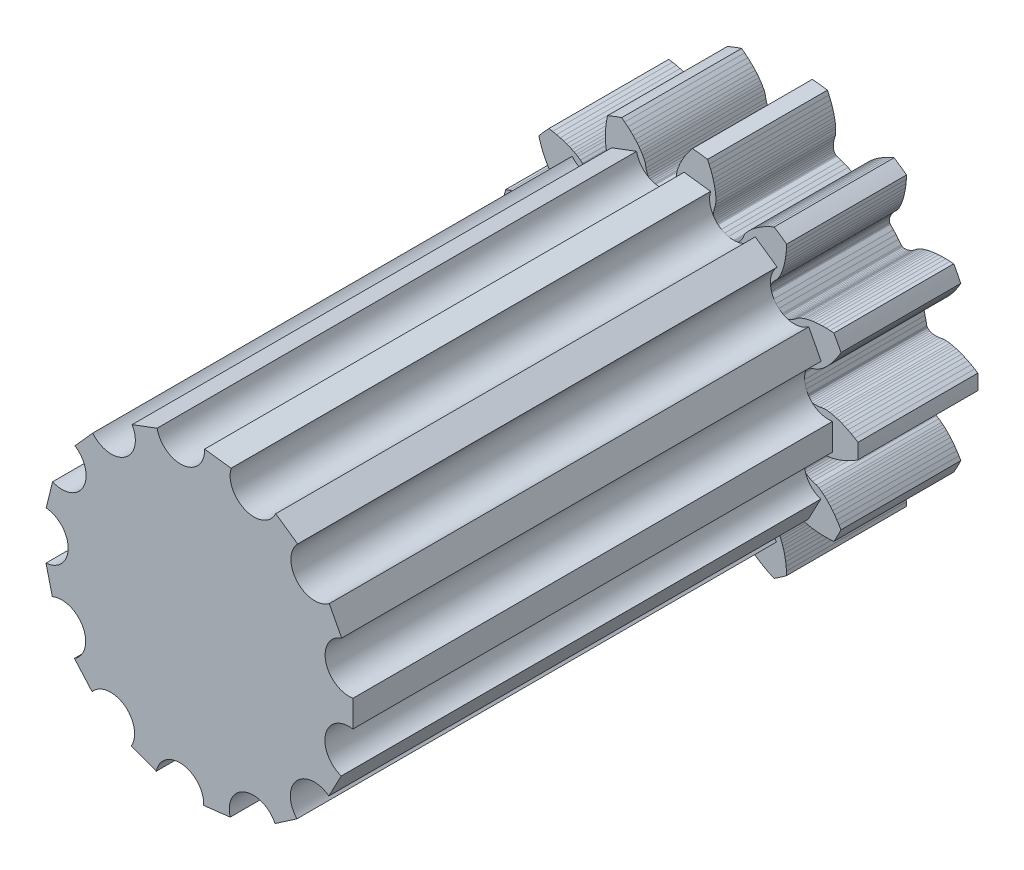
from build123d import *

# Parameters (mm, degrees)
MODEL_R             = 0.75
BOSS_EXTRUDE1_DEPTH = 5
BOSS_EXTRUDE2_DEPTH = 20


with BuildPart() as part:
    # Model → Boss-Extrude1 (new body)
    with BuildSketch(Plane.XY):
        with BuildLine():
            Line((13.7260021, -4.5793472), (13.7795433, -4.4215508))
            Line((13.7795433, -4.4215508), (13.8361657, -4.2750909))
            Line((13.8361657, -4.2750909), (13.8946398, -4.1408954))
            Line((13.8946398, -4.1408954), (13.9531112, -4.0206601))
            Line((13.9531112, -4.0206601), (14.0125959, -3.9103171))
            Line((14.0125959, -3.9103171), (14.0709776, -3.8121176))
            Line((14.0709776, -3.8121176), (14.1273517, -3.7257798))
            Line((14.1273517, -3.7257798), (14.1809425, -3.6507508))
            Line((14.1809425, -3.6507508), (14.2314909, -3.585913))
            Line((14.2314909, -3.585913), (14.3186959, -3.4872224))
            Line((14.3186959, -3.4872224), (14.4038321, -3.4081956))
            Line((14.4038321, -3.4081956), (14.5510585, -3.3203205))
            Line((14.5510585, -3.3203205), (14.6360097, -3.2587152))
            Line((14.6360097, -3.2587152), (14.7072172, -3.1962934))
            Line((14.7072172, -3.1962934), (14.7647907, -3.1340817))
            Line((14.7647907, -3.1340817), (14.8088891, -3.0731147))
            Line((14.8088891, -3.0731147), (14.8397293, -3.014408))
            Line((14.8397293, -3.014408), (14.8576125, -2.9589443))
            Line((14.8576125, -2.9589443), (14.8628531, -2.9077103))
            Line((14.8628531, -2.9077103), (14.8608788, -2.8839796))
            Line((14.8608788, -2.8839796), (14.8558904, -2.8616501))
            Line((14.8558904, -2.8616501), (14.8429207, -2.831064))
            Line((14.8429207, -2.831064), (14.7494086, -2.6710529))
            Line((14.7494086, -2.6710529), (14.6742647, -2.5327413))
            Line((14.6742647, -2.5327413), (14.603123, -2.3923291))
            Line((14.603123, -2.3923291), (14.5245574, -2.2244735))
            Line((14.5245574, -2.2244735), (14.5067531, -2.1964247))
            Line((14.5067531, -2.1964247), (14.4912101, -2.1796348))
            Line((14.4912101, -2.1796348), (14.4728017, -2.1645293))
            Line((14.4728017, -2.1645293), (14.4276599, -2.1397381))
            Line((14.4276599, -2.1397381), (14.3718553, -2.1229486))
            Line((14.3718553, -2.1229486), (14.3060215, -2.1149804))
            Line((14.3060215, -2.1149804), (14.2307959, -2.1166396))
            Line((14.2307959, -2.1166396), (14.1468912, -2.1286813))
            Line((14.1468912, -2.1286813), (14.0550685, -2.1518243))
            Line((14.0550685, -2.1518243), (13.9561106, -2.186742))
            Line((13.9561106, -2.186742), (13.8001567, -2.2579882))
            Line((13.8001567, -2.2579882), (13.686756, -2.2831616))
            Line((13.686756, -2.2831616), (13.5559972, -2.2988672))
            Line((13.5559972, -2.2988672), (13.473922, -2.3036357))
            Line((13.473922, -2.3036357), (13.3817313, -2.3051187))
            Line((13.3817313, -2.3051187), (13.2786525, -2.3024682))
            Line((13.2786525, -2.3024682), (13.1646713, -2.2947317))
            Line((13.1646713, -2.2947317), (13.0400696, -2.2810047))
            Line((13.0400696, -2.2810047), (12.9079024, -2.2608243))
            Line((12.9079024, -2.2608243), (12.7642446, -2.2327158))
            Line((12.7642446, -2.2327158), (12.6115452, -2.1961165))
            Line((12.6115452, -2.1961165), (12.4512665, -2.1505414))
            Line((12.4512665, -2.1505414), (12.300297737, -2.10092279))
            ThreePointArc((12.300297737, -2.10092279), (12.217962976, -1.794860908), (12.148632736, -1.485593699))
            Line((12.148632736, -1.485593699), (12.25925, -1.3715))
            Line((12.25925, -1.3715), (12.37999, -1.25666))
            Line((12.37999, -1.25666), (12.49819, -1.15329))
            Line((12.49819, -1.15329), (12.61233, -1.06164))
            Line((12.61233, -1.06164), (12.71998, -0.98235))
            Line((12.71998, -0.98235), (12.82393, -0.91229))
            Line((12.82393, -0.91229), (12.92126, -0.85247))
            Line((12.92126, -0.85247), (13.0113, -0.80222))
            Line((13.0113, -0.80222), (13.09362, -0.76069))
            Line((13.09362, -0.76069), (13.16851, -0.72677))
            Line((13.16851, -0.72677), (13.29159, -0.67991))
            Line((13.29159, -0.67991), (13.4037, -0.6495))
            Line((13.4037, -0.6495), (13.5749, -0.64011))
            Line((13.5749, -0.64011), (13.67875, -0.62504))
            Line((13.67875, -0.62504), (13.77081, -0.60286))
            Line((13.77081, -0.60286), (13.8507, -0.57453))
            Line((13.8507, -0.57453), (13.91808, -0.54104))
            Line((13.91808, -0.54104), (13.97267, -0.50339))
            Line((13.97267, -0.50339), (14.01428, -0.46259))
            Line((14.01428, -0.46259), (14.04273, -0.41966))
            Line((14.04273, -0.41966), (14.05201, -0.39773))
            Line((14.05201, -0.39773), (14.05797, -0.37564))
            Line((14.05797, -0.37564), (14.0607, -0.34253))
            Line((14.0607, -0.34253), (14.05226, -0.15739))
            Line((14.05226, -0.15739), (14.05, 0))
            Line((14.05, 0), (14.05226, 0.15739))
            Line((14.05226, 0.15739), (14.0607, 0.34253))
            Line((14.0607, 0.34253), (14.05797, 0.37564))
            Line((14.05797, 0.37564), (14.05201, 0.39773))
            Line((14.05201, 0.39773), (14.04273, 0.41966))
            Line((14.04273, 0.41966), (14.01428, 0.46259))
            Line((14.01428, 0.46259), (13.97267, 0.50339))
            Line((13.97267, 0.50339), (13.91808, 0.54104))
            Line((13.91808, 0.54104), (13.8507, 0.57453))
            Line((13.8507, 0.57453), (13.77081, 0.60286))
            Line((13.77081, 0.60286), (13.67875, 0.62504))
            Line((13.67875, 0.62504), (13.5749, 0.64011))
            Line((13.5749, 0.64011), (13.4037, 0.6495))
            Line((13.4037, 0.6495), (13.29159, 0.67991))
            Line((13.29159, 0.67991), (13.16851, 0.72677))
            Line((13.16851, 0.72677), (13.09362, 0.76069))
            Line((13.09362, 0.76069), (13.0113, 0.80222))
            Line((13.0113, 0.80222), (12.92126, 0.85247))
            Line((12.92126, 0.85247), (12.82393, 0.91229))
            Line((12.82393, 0.91229), (12.71998, 0.98235))
            Line((12.71998, 0.98235), (12.61233, 1.06164))
            Line((12.61233, 1.06164), (12.49819, 1.15329))
            Line((12.49819, 1.15329), (12.37999, 1.25666))
            Line((12.37999, 1.25666), (12.25925, 1.3715))
            Line((12.25925, 1.3715), (12.148632715, 1.485593697))
            ThreePointArc((12.148632715, 1.485593697), (12.217962952, 1.794860913), (12.300297712, 2.100922802))
            Line((12.300297712, 2.100922802), (12.4512665, 2.1505414))
            Line((12.4512665, 2.1505414), (12.6115452, 2.1961165))
            Line((12.6115452, 2.1961165), (12.7642446, 2.2327158))
            Line((12.7642446, 2.2327158), (12.9079024, 2.2608243))
            Line((12.9079024, 2.2608243), (13.0400696, 2.2810047))
            Line((13.0400696, 2.2810047), (13.1646713, 2.2947317))
            Line((13.1646713, 2.2947317), (13.2786525, 2.3024682))
            Line((13.2786525, 2.3024682), (13.3817313, 2.3051187))
            Line((13.3817313, 2.3051187), (13.473922, 2.3036357))
            Line((13.473922, 2.3036357), (13.5559972, 2.2988672))
            Line((13.5559972, 2.2988672), (13.686756, 2.2831616))
            Line((13.686756, 2.2831616), (13.8001567, 2.2579882))
            Line((13.8001567, 2.2579882), (13.9561106, 2.186742))
            Line((13.9561106, 2.186742), (14.0550685, 2.1518243))
            Line((14.0550685, 2.1518243), (14.1468912, 2.1286813))
            Line((14.1468912, 2.1286813), (14.2307959, 2.1166396))
            Line((14.2307959, 2.1166396), (14.3060215, 2.1149804))
            Line((14.3060215, 2.1149804), (14.3718553, 2.1229486))
            Line((14.3718553, 2.1229486), (14.4276599, 2.1397381))
            Line((14.4276599, 2.1397381), (14.4728017, 2.1645293))
            Line((14.4728017, 2.1645293), (14.4912101, 2.1796348))
            Line((14.4912101, 2.1796348), (14.5067531, 2.1964247))
            Line((14.5067531, 2.1964247), (14.5245574, 2.2244735))
            Line((14.5245574, 2.2244735), (14.603123, 2.3923291))
            Line((14.603123, 2.3923291), (14.6742647, 2.5327413))
            Line((14.6742647, 2.5327413), (14.7494086, 2.6710529))
            Line((14.7494086, 2.6710529), (14.8429207, 2.831064))
            Line((14.8429207, 2.831064), (14.8558904, 2.8616501))
            Line((14.8558904, 2.8616501), (14.8608788, 2.8839796))
            Line((14.8608788, 2.8839796), (14.8628531, 2.9077103))
            Line((14.8628531, 2.9077103), (14.8576125, 2.9589443))
            Line((14.8576125, 2.9589443), (14.8397293, 3.014408))
            Line((14.8397293, 3.014408), (14.8088891, 3.0731147))
            Line((14.8088891, 3.0731147), (14.7647907, 3.1340817))
            Line((14.7647907, 3.1340817), (14.7072172, 3.1962934))
            Line((14.7072172, 3.1962934), (14.6360097, 3.2587152))
            Line((14.6360097, 3.2587152), (14.5510585, 3.3203205))
            Line((14.5510585, 3.3203205), (14.4038321, 3.4081956))
            Line((14.4038321, 3.4081956), (14.3186959, 3.4872224))
            Line((14.3186959, 3.4872224), (14.2314909, 3.585913))
            Line((14.2314909, 3.585913), (14.1809425, 3.6507508))
            Line((14.1809425, 3.6507508), (14.1273517, 3.7257798))
            Line((14.1273517, 3.7257798), (14.0709776, 3.8121176))
            Line((14.0709776, 3.8121176), (14.0125959, 3.9103171))
            Line((14.0125959, 3.9103171), (13.9531112, 4.0206601))
            Line((13.9531112, 4.0206601), (13.8946398, 4.1408954))
            Line((13.8946398, 4.1408954), (13.8361657, 4.2750909))
            Line((13.8361657, 4.2750909), (13.7795433, 4.4215508))
            Line((13.7795433, 4.4215508), (13.7260021, 4.5793472))
            Line((13.7260021, 4.5793472), (13.681077363, 4.731778626))
            ThreePointArc((13.681077363, 4.731778626), (13.886189894, 4.973401768), (14.101327766, 5.206143231))
            Line((14.101327766, 5.206143231), (14.2580628, 5.1799196))
            Line((14.2580628, 5.1799196), (14.4211624, 5.1457891))
            Line((14.4211624, 5.1457891), (14.5733795, 5.1072333))
            Line((14.5733795, 5.1072333), (14.7136449, 5.065361))
            Line((14.7136449, 5.065361), (14.8400515, 5.0218087))
            Line((14.8400515, 5.0218087), (14.95676, 4.9760581))
            Line((14.95676, 4.9760581), (15.0612807, 4.9299387))
            Line((15.0612807, 4.9299387), (15.1537842, 4.8843825))
            Line((15.1537842, 4.8843825), (15.2347258, 4.8402262))
            Line((15.2347258, 4.8402262), (15.3051838, 4.7978617))
            Line((15.3051838, 4.7978617), (15.4136662, 4.7231884))
            Line((15.4136662, 4.7231884), (15.5023789, 4.6481985))
            Line((15.5023789, 4.6481985), (15.6073594, 4.5126378))
            Line((15.6073594, 4.5126378), (15.6787553, 4.4357316))
            Line((15.6787553, 4.4357316), (15.7493051, 4.3725674))
            Line((15.7493051, 4.3725674), (15.8180029, 4.3229125))
            Line((15.8180029, 4.3229125), (15.8838408, 4.2864844))
            Line((15.8838408, 4.2864844), (15.9458368, 4.2629453))
            Line((15.9458368, 4.2629453), (16.0030518, 4.251878))
            Line((16.0030518, 4.251878), (16.0545439, 4.2528511))
            Line((16.0545439, 4.2528511), (16.0778636, 4.2576715))
            Line((16.0778636, 4.2576715), (16.0994289, 4.265315))
            Line((16.0994289, 4.265315), (16.1282288, 4.2818769))
            Line((16.1282288, 4.2818769), (16.2758015, 4.3939944))
            Line((16.2758015, 4.3939944), (16.4040471, 4.4852621))
            Line((16.4040471, 4.4852621), (16.5348604, 4.5728098))
            Line((16.5348604, 4.5728098), (16.6920221, 4.6710354))
            Line((16.6920221, 4.6710354), (16.7177203, 4.6920907))
            Line((16.7177203, 4.6920907), (16.7325143, 4.7095443))
            Line((16.7325143, 4.7095443), (16.7452907, 4.7296392))
            Line((16.7452907, 4.7296392), (16.76446, 4.7774401))
            Line((16.76446, 4.7774401), (16.7744005, 4.8348615))
            Line((16.7744005, 4.8348615), (16.7743752, 4.9011759))
            Line((16.7743752, 4.9011759), (16.7636607, 4.975653))
            Line((16.7636607, 4.975653), (16.7415932, 5.0574944))
            Line((16.7415932, 5.0574944), (16.7075509, 5.145858))
            Line((16.7075509, 5.145858), (16.6609598, 5.2398856))
            Line((16.6609598, 5.2398856), (16.5714349, 5.3861146))
            Line((16.5714349, 5.3861146), (16.5327761, 5.4956542))
            Line((16.5327761, 5.4956542), (16.5014237, 5.6235665))
            Line((16.5014237, 5.6235665), (16.486797, 5.7044686))
            Line((16.486797, 5.7044686), (16.4742124, 5.7958083))
            Line((16.4742124, 5.7958083), (16.4644188, 5.898455))
            Line((16.4644188, 5.898455), (16.4583599, 6.0125377))
            Line((16.4583599, 6.0125377), (16.4569679, 6.1378855))
            Line((16.4569679, 6.1378855), (16.4610701, 6.2715215))
            Line((16.4610701, 6.2715215), (16.4716576, 6.4175201))
            Line((16.4716576, 6.4175201), (16.4895842, 6.5735176))
            Line((16.4895842, 6.5735176), (16.5155076, 6.7381212))
            Line((16.5155076, 6.7381212), (16.546567086, 6.89397013))
            ThreePointArc((16.546567086, 6.89397013), (16.840473098, 7.012596253), (17.139128588, 7.118699031))
            Line((17.139128588, 7.118699031), (17.2657238, 7.0226407))
            Line((17.2657238, 7.0226407), (17.3942801, 6.9166235))
            Line((17.3942801, 6.9166235), (17.5111438, 6.8117452))
            Line((17.5111438, 6.8117452), (17.6158837, 6.7094846))
            Line((17.6158837, 6.7094846), (17.7075713, 6.6121768))
            Line((17.7075713, 6.6121768), (17.7896503, 6.5174295))
            Line((17.7896503, 6.5174295), (17.860766, 6.4280197))
            Line((17.860766, 6.4280197), (17.9215027, 6.3446931))
            Line((17.9215027, 6.3446931), (17.9726525, 6.2679792))
            Line((17.9726525, 6.2679792), (18.0153522, 6.1977239))
            Line((18.0153522, 6.1977239), (18.0767062, 6.0811896))
            Line((18.0767062, 6.0811896), (18.1204078, 5.9735625))
            Line((18.1204078, 5.9735625), (18.1503652, 5.8047426))
            Line((18.1503652, 5.8047426), (18.1778431, 5.7034663))
            Line((18.1778431, 5.7034663), (18.210958, 5.614751))
            Line((18.210958, 5.614751), (18.2487111, 5.5388583))
            Line((18.2487111, 5.5388583), (18.2900787, 5.4760064))
            Line((18.2900787, 5.4760064), (18.3340343, 5.4263526))
            Line((18.3340343, 5.4263526), (18.3795523, 5.3899639))
            Line((18.3795523, 5.3899639), (18.4255986, 5.3668959))
            Line((18.4255986, 5.3668959), (18.4484873, 5.360327))
            Line((18.4484873, 5.360327), (18.4711346, 5.3570731))
            Line((18.4711346, 5.3570731), (18.5043323, 5.3583539))
            Line((18.5043323, 5.3583539), (18.6871051, 5.3890486))
            Line((18.6871051, 5.3890486), (18.8430751, 5.4102634))
            Line((18.8430751, 5.4102634), (18.99959, 5.4269911))
            Line((18.99959, 5.4269911), (19.1843974, 5.4409288))
            Line((19.1843974, 5.4409288), (19.2169369, 5.4476299))
            Line((19.2169369, 5.4476299), (19.2381475, 5.4562091))
            Line((19.2381475, 5.4562091), (19.258799, 5.4680648))
            Line((19.258799, 5.4680648), (19.2979867, 5.501482))
            Line((19.2979867, 5.501482), (19.3334737, 5.5477065))
            Line((19.3334737, 5.5477065), (19.3642691, 5.6064367))
            Line((19.3642691, 5.6064367), (19.3893932, 5.6773622))
            Line((19.3893932, 5.6773622), (19.4078869, 5.7600845))
            Line((19.4078869, 5.7600845), (19.4188086, 5.8541468))
            Line((19.4188086, 5.8541468), (19.421251, 5.9590561))
            Line((19.421251, 5.9590561), (19.4099366, 6.1301397))
            Line((19.4099366, 6.1301397), (19.4266116, 6.2450978))
            Line((19.4266116, 6.2450978), (19.4582942, 6.3729288))
            Line((19.4582942, 6.3729288), (19.4829399, 6.4513613))
            Line((19.4829399, 6.4513613), (19.5142446, 6.538087))
            Line((19.5142446, 6.538087), (19.5532751, 6.6335275))
            Line((19.5532751, 6.6335275), (19.6009271, 6.7373583))
            Line((19.6009271, 6.7373583), (19.6579465, 6.8489952))
            Line((19.6579465, 6.8489952), (19.7236826, 6.9654177))
            Line((19.7236826, 6.9654177), (19.8009063, 7.0897727))
            Line((19.8009063, 7.0897727), (19.8892752, 7.2195707))
            Line((19.8892752, 7.2195707), (19.9887243, 7.3532728))
            Line((19.9887243, 7.3532728), (20.088652705, 7.47683613))
            ThreePointArc((20.088652705, 7.47683613), (20.404021869, 7.445289411), (20.717776598, 7.400446627))
            Line((20.717776598, 7.400446627), (20.7852306, 7.2565595))
            Line((20.7852306, 7.2565595), (20.8497928, 7.1029428))
            Line((20.8497928, 7.1029428), (20.9045312, 6.9557683))
            Line((20.9045312, 6.9557683), (20.9497508, 6.8165461))
            Line((20.9497508, 6.8165461), (20.985715, 6.6877749))
            Line((20.985715, 6.6877749), (21.0143611, 6.5657364))
            Line((21.0143611, 6.5657364), (21.0357801, 6.4535188))
            Line((21.0357801, 6.4535188), (21.050836, 6.351511))
            Line((21.050836, 6.351511), (21.0604762, 6.2598137))
            Line((21.0604762, 6.2598137), (21.0656355, 6.1777622))
            Line((21.0656355, 6.1777622), (21.0658056, 6.0460636))
            Line((21.0658056, 6.0460636), (21.0544847, 5.9304554))
            Line((21.0544847, 5.9304554), (21.0025562, 5.7670509))
            Line((21.0025562, 5.7670509), (20.9798211, 5.6646055))
            Line((20.9798211, 5.6646055), (20.9679149, 5.5706628))
            Line((20.9679149, 5.5706628), (20.9660745, 5.4859184))
            Line((20.9660745, 5.4859184), (20.9734949, 5.4110413))
            Line((20.9734949, 5.4110413), (20.9893404, 5.3466479))
            Line((20.9893404, 5.3466479), (21.012734, 5.293274))
            Line((21.012734, 5.293274), (21.0427857, 5.2514496))
            Line((21.0427857, 5.2514496), (21.0599999, 5.2349961))
            Line((21.0599999, 5.2349961), (21.0785409, 5.2215902))
            Line((21.0785409, 5.2215902), (21.1085312, 5.2072967))
            Line((21.1085312, 5.2072967), (21.284633, 5.1495366))
            Line((21.284633, 5.1495366), (21.4325966, 5.0958385))
            Line((21.4325966, 5.0958385), (21.5789574, 5.0379141))
            Line((21.5789574, 5.0379141), (21.7490735, 4.964371))
            Line((21.7490735, 4.964371), (21.7809999, 4.9551827))
            Line((21.7809999, 4.9551827), (21.8037679, 4.9529221))
            Line((21.8037679, 4.9529221), (21.8275635, 4.9538226))
            Line((21.8275635, 4.9538226), (21.8777923, 4.9652006))
            Line((21.8777923, 4.9652006), (21.9306961, 4.9896388))
            Line((21.9306961, 4.9896388), (21.9852573, 5.0273304))
            Line((21.9852573, 5.0273304), (22.0404643, 5.0784561))
            Line((22.0404643, 5.0784561), (22.0952827, 5.1431086))
            Line((22.0952827, 5.1431086), (22.1486663, 5.2213211))
            Line((22.1486663, 5.2213211), (22.1995827, 5.3130786))
            Line((22.1995827, 5.3130786), (22.2690708, 5.4698236))
            Line((22.2690708, 5.4698236), (22.3372594, 5.5638648))
            Line((22.3372594, 5.5638648), (22.4247191, 5.6623298))
            Line((22.4247191, 5.6623298), (22.4829912, 5.720325))
            Line((22.4829912, 5.720325), (22.5510135, 5.7825688))
            Line((22.5510135, 5.7825688), (22.6299267, 5.8489387))
            Line((22.6299267, 5.8489387), (22.720373, 5.9187314))
            Line((22.720373, 5.9187314), (22.8227414, 5.9910827))
            Line((22.8227414, 5.9910827), (22.9350521, 6.0636206))
            Line((22.9350521, 6.0636206), (23.0612209, 6.1378438))
            Line((23.0612209, 6.1378438), (23.1997879, 6.2117072))
            Line((23.1997879, 6.2117072), (23.3499801, 6.2838783))
            Line((23.3499801, 6.2838783), (23.495884993, 6.346848985))
            ThreePointArc((23.495884993, 6.346848985), (23.760470044, 6.172356395), (24.017446594, 5.986840988))
            Line((24.017446594, 5.986840988), (24.0103065, 5.8280879))
            Line((24.0103065, 5.8280879), (23.9960843, 5.6620635))
            Line((23.9960843, 5.6620635), (23.9761573, 5.5063088))
            Line((23.9761573, 5.5063088), (23.9514975, 5.362019))
            Line((23.9514975, 5.362019), (23.9234993, 5.2312844))
            Line((23.9234993, 5.2312844), (23.89215, 5.1099122))
            Line((23.89215, 5.1099122), (23.8589654, 5.0005945))
            Line((23.8589654, 5.0005945), (23.8248914, 4.9032743))
            Line((23.8248914, 4.9032743), (23.7908135, 4.8176004))
            Line((23.7908135, 4.8176004), (23.7572507, 4.7425496))
            Line((23.7572507, 4.7425496), (23.6961979, 4.6258573))
            Line((23.6961979, 4.6258573), (23.6324479, 4.5287524))
            Line((23.6324479, 4.5287524), (23.5105296, 4.4081973))
            Line((23.5105296, 4.4081973), (23.44279, 4.3280519))
            Line((23.44279, 4.3280519), (23.3885902, 4.2504029))
            Line((23.3885902, 4.2504029), (23.3475779, 4.1762207))
            Line((23.3475779, 4.1762207), (23.3193512, 4.1064719))
            Line((23.3193512, 4.1064719), (23.3034566, 4.0420906))
            Line((23.3034566, 4.0420906), (23.2993665, 3.9839588))
            Line((23.2993665, 3.9839588), (23.3065392, 3.9329594))
            Line((23.3065392, 3.9329594), (23.3141353, 3.9103908))
            Line((23.3141353, 3.9103908), (23.3243226, 3.889904))
            Line((23.3243226, 3.889904), (23.3442351, 3.8633105))
            Line((23.3442351, 3.8633105), (23.4733231, 3.7303279))
            Line((23.4733231, 3.7303279), (23.5793836, 3.6140185))
            Line((23.5793836, 3.6140185), (23.6820608, 3.4947117))
            Line((23.6820608, 3.4947117), (23.7985139, 3.3505357))
            Line((23.7985139, 3.3505357), (23.8225133, 3.3275628))
            Line((23.8225133, 3.3275628), (23.8416228, 3.3149804))
            Line((23.8416228, 3.3149804), (23.8631113, 3.3047194))
            Line((23.8631113, 3.3047194), (23.9128743, 3.2914516))
            Line((23.9128743, 3.2914516), (23.9710752, 3.2885049))
            Line((23.9710752, 3.2885049), (24.036903, 3.2965234))
            Line((24.036903, 3.2965234), (24.1095456, 3.316137))
            Line((24.1095456, 3.316137), (24.1881304, 3.3479085))
            Line((24.1881304, 3.3479085), (24.2717464, 3.3923536))
            Line((24.2717464, 3.3923536), (24.3594725, 3.4499388))
            Line((24.3594725, 3.4499388), (24.4938442, 3.5564369))
            Line((24.4938442, 3.5564369), (24.5979253, 3.6080174))
            Line((24.5979253, 3.6080174), (24.721126, 3.6545593))
            Line((24.721126, 3.6545593), (24.7996751, 3.6788311))
            Line((24.7996751, 3.6788311), (24.888832, 3.7023337))
            Line((24.888832, 3.7023337), (24.9895498, 3.7244286))
            Line((24.9895498, 3.7244286), (25.1020703, 3.7441944))
            Line((25.1020703, 3.7441944), (25.2263364, 3.7606854))
            Line((25.2263364, 3.7606854), (25.3594926, 3.7727211))
            Line((25.3594926, 3.7727211), (25.5057028, 3.7798089))
            Line((25.5057028, 3.7798089), (25.6627237, 3.7808164))
            Line((25.6627237, 3.7808164), (25.8292519, 3.7749229))
            Line((25.8292519, 3.7749229), (25.987708276, 3.762875389))
            ThreePointArc((25.987708276, 3.762875389), (26.140895483, 3.485410816), (26.282224078, 3.201722389))
            Line((26.282224078, 3.201722389), (26.2021255, 3.0644716))
            Line((26.2021255, 3.0644716), (26.112377, 2.9240737))
            Line((26.112377, 2.9240737), (26.0223498, 2.7954203))
            Line((26.0223498, 2.7954203), (25.9334597, 2.679118))
            Line((25.9334597, 2.679118), (25.8479132, 2.5763697))
            Line((25.8479132, 2.5763697), (25.7637503, 2.4834686))
            Line((25.7637503, 2.4834686), (25.6835643, 2.4020943))
            Line((25.6835643, 2.4020943), (25.6081664, 2.3317565))
            Line((25.6081664, 2.3317565), (25.5381772, 2.2717328))
            Line((25.5381772, 2.2717328), (25.473581, 2.2208761))
            Line((25.473581, 2.2208761), (25.3652918, 2.1459228))
            Line((25.3652918, 2.1459228), (25.2637171, 2.0895668))
            Line((25.2637171, 2.0895668), (25.099739, 2.0394788))
            Line((25.099739, 2.0394788), (25.0025132, 1.9999938))
            Line((25.0025132, 1.9999938), (24.9184363, 1.9564269))
            Line((24.9184363, 1.9564269), (24.8476476, 1.9098012))
            Line((24.8476476, 1.9098012), (24.7902402, 1.8611593))
            Line((24.7902402, 1.8611593), (24.7462467, 1.8115391))
            Line((24.7462467, 1.8115391), (24.7156099, 1.7619667))
            Line((24.7156099, 1.7619667), (24.6982604, 1.7134756))
            Line((24.6982604, 1.7134756), (24.6944983, 1.689962))
            Line((24.6944983, 1.689962), (24.693998, 1.6670876))
            Line((24.693998, 1.6670876), (24.699271, 1.6342864))
            Line((24.699271, 1.6342864), (24.7517727, 1.456546))
            Line((24.7517727, 1.456546), (24.7916329, 1.3042704))
            Line((24.7916329, 1.3042704), (24.8271045, 1.150913))
            Line((24.8271045, 1.150913), (24.8632166, 0.969133))
            Line((24.8632166, 0.969133), (24.873791, 0.9376384))
            Line((24.873791, 0.9376384), (24.8848643, 0.9176167))
            Line((24.8848643, 0.9176167), (24.8991229, 0.8985448))
            Line((24.8991229, 0.8985448), (24.93702, 0.8636708))
            Line((24.93702, 0.8636708), (24.9871849, 0.8340142))
            Line((24.9871849, 0.8340142), (25.0491989, 0.8105225))
            Line((25.0491989, 0.8105225), (25.1226356, 0.7941308))
            Line((25.1226356, 0.7941308), (25.206984, 0.7857429))
            Line((25.206984, 0.7857429), (25.3016769, 0.7862388))
            Line((25.3016769, 0.7862388), (25.4061157, 0.7964597))
            Line((25.4061157, 0.7964597), (25.5745881, 0.8283134))
            Line((25.5745881, 0.8283134), (25.690718, 0.8256167))
            Line((25.690718, 0.8256167), (25.8214359, 0.8095734))
            Line((25.8214359, 0.8095734), (25.9022673, 0.7945614))
            Line((25.9022673, 0.7945614), (25.992134, 0.7739386))
            Line((25.992134, 0.7739386), (26.0915832, 0.7466968))
            Line((26.0915832, 0.7466968), (26.2004008, 0.7119076))
            Line((26.2004008, 0.7119076), (26.3180967, 0.6687603))
            Line((26.3180967, 0.6687603), (26.4415939, 0.6175367))
            Line((26.4415939, 0.6175367), (26.5743505, 0.5558653))
            Line((26.5743505, 0.5558653), (26.7138539, 0.4837862))
            Line((26.7138539, 0.4837862), (26.8585684, 0.4011782))
            Line((26.8585684, 0.4011782), (26.99327574, 0.316872298))
            ThreePointArc((26.99327574, 0.316872298), (26.9999726, 0), (26.99327574, -0.316872298))
            Line((26.99327574, -0.316872298), (26.8585684, -0.4011782))
            Line((26.8585684, -0.4011782), (26.7138539, -0.4837862))
            Line((26.7138539, -0.4837862), (26.5743505, -0.5558653))
            Line((26.5743505, -0.5558653), (26.4415939, -0.6175367))
            Line((26.4415939, -0.6175367), (26.3180967, -0.6687603))
            Line((26.3180967, -0.6687603), (26.2004008, -0.7119076))
            Line((26.2004008, -0.7119076), (26.0915832, -0.7466968))
            Line((26.0915832, -0.7466968), (25.992134, -0.7739386))
            Line((25.992134, -0.7739386), (25.9022673, -0.7945614))
            Line((25.9022673, -0.7945614), (25.8214359, -0.8095734))
            Line((25.8214359, -0.8095734), (25.690718, -0.8256167))
            Line((25.690718, -0.8256167), (25.5745881, -0.8283134))
            Line((25.5745881, -0.8283134), (25.4061157, -0.7964597))
            Line((25.4061157, -0.7964597), (25.3016769, -0.7862388))
            Line((25.3016769, -0.7862388), (25.206984, -0.7857429))
            Line((25.206984, -0.7857429), (25.1226356, -0.7941308))
            Line((25.1226356, -0.7941308), (25.0491989, -0.8105225))
            Line((25.0491989, -0.8105225), (24.9871849, -0.8340142))
            Line((24.9871849, -0.8340142), (24.93702, -0.8636708))
            Line((24.93702, -0.8636708), (24.8991229, -0.8985448))
            Line((24.8991229, -0.8985448), (24.8848643, -0.9176167))
            Line((24.8848643, -0.9176167), (24.873791, -0.9376384))
            Line((24.873791, -0.9376384), (24.8632166, -0.969133))
            Line((24.8632166, -0.969133), (24.8271045, -1.150913))
            Line((24.8271045, -1.150913), (24.7916329, -1.3042704))
            Line((24.7916329, -1.3042704), (24.7517727, -1.456546))
            Line((24.7517727, -1.456546), (24.699271, -1.6342864))
            Line((24.699271, -1.6342864), (24.693998, -1.6670876))
            Line((24.693998, -1.6670876), (24.6944983, -1.689962))
            Line((24.6944983, -1.689962), (24.6982604, -1.7134756))
            Line((24.6982604, -1.7134756), (24.7156099, -1.7619667))
            Line((24.7156099, -1.7619667), (24.7462467, -1.8115391))
            Line((24.7462467, -1.8115391), (24.7902402, -1.8611593))
            Line((24.7902402, -1.8611593), (24.8476476, -1.9098012))
            Line((24.8476476, -1.9098012), (24.9184363, -1.9564269))
            Line((24.9184363, -1.9564269), (25.0025132, -1.9999938))
            Line((25.0025132, -1.9999938), (25.099739, -2.0394788))
            Line((25.099739, -2.0394788), (25.2637171, -2.0895668))
            Line((25.2637171, -2.0895668), (25.3652918, -2.1459228))
            Line((25.3652918, -2.1459228), (25.473581, -2.2208761))
            Line((25.473581, -2.2208761), (25.5381772, -2.2717328))
            Line((25.5381772, -2.2717328), (25.6081664, -2.3317565))
            Line((25.6081664, -2.3317565), (25.6835643, -2.4020943))
            Line((25.6835643, -2.4020943), (25.7637503, -2.4834686))
            Line((25.7637503, -2.4834686), (25.8479132, -2.5763697))
            Line((25.8479132, -2.5763697), (25.9334597, -2.679118))
            Line((25.9334597, -2.679118), (26.0223498, -2.7954203))
            Line((26.0223498, -2.7954203), (26.112377, -2.9240737))
            Line((26.112377, -2.9240737), (26.2021255, -3.0644716))
            Line((26.2021255, -3.0644716), (26.282224078, -3.201722389))
            ThreePointArc((26.282224078, -3.201722389), (26.140895953, -3.485411075), (25.987708276, -3.762875389))
            Line((25.987708276, -3.762875389), (25.8292519, -3.7749229))
            Line((25.8292519, -3.7749229), (25.6627237, -3.7808164))
            Line((25.6627237, -3.7808164), (25.5057028, -3.7798089))
            Line((25.5057028, -3.7798089), (25.3594926, -3.7727211))
            Line((25.3594926, -3.7727211), (25.2263364, -3.7606854))
            Line((25.2263364, -3.7606854), (25.1020703, -3.7441944))
            Line((25.1020703, -3.7441944), (24.9895498, -3.7244286))
            Line((24.9895498, -3.7244286), (24.888832, -3.7023337))
            Line((24.888832, -3.7023337), (24.7996751, -3.6788311))
            Line((24.7996751, -3.6788311), (24.721126, -3.6545593))
            Line((24.721126, -3.6545593), (24.5979253, -3.6080174))
            Line((24.5979253, -3.6080174), (24.4938442, -3.5564369))
            Line((24.4938442, -3.5564369), (24.3594725, -3.4499388))
            Line((24.3594725, -3.4499388), (24.2717464, -3.3923536))
            Line((24.2717464, -3.3923536), (24.1881304, -3.3479085))
            Line((24.1881304, -3.3479085), (24.1095456, -3.316137))
            Line((24.1095456, -3.316137), (24.036903, -3.2965234))
            Line((24.036903, -3.2965234), (23.9710752, -3.2885049))
            Line((23.9710752, -3.2885049), (23.9128743, -3.2914516))
            Line((23.9128743, -3.2914516), (23.8631113, -3.3047194))
            Line((23.8631113, -3.3047194), (23.8416228, -3.3149804))
            Line((23.8416228, -3.3149804), (23.8225133, -3.3275628))
            Line((23.8225133, -3.3275628), (23.7985139, -3.3505357))
            Line((23.7985139, -3.3505357), (23.6820608, -3.4947117))
            Line((23.6820608, -3.4947117), (23.5793836, -3.6140185))
            Line((23.5793836, -3.6140185), (23.4733231, -3.7303279))
            Line((23.4733231, -3.7303279), (23.3442351, -3.8633105))
            Line((23.3442351, -3.8633105), (23.3243226, -3.889904))
            Line((23.3243226, -3.889904), (23.3141353, -3.9103908))
            Line((23.3141353, -3.9103908), (23.3065392, -3.9329594))
            Line((23.3065392, -3.9329594), (23.2993665, -3.9839588))
            Line((23.2993665, -3.9839588), (23.3034566, -4.0420906))
            Line((23.3034566, -4.0420906), (23.3193512, -4.1064719))
            Line((23.3193512, -4.1064719), (23.3475779, -4.1762207))
            Line((23.3475779, -4.1762207), (23.3885902, -4.2504029))
            Line((23.3885902, -4.2504029), (23.44279, -4.3280519))
            Line((23.44279, -4.3280519), (23.5105296, -4.4081973))
            Line((23.5105296, -4.4081973), (23.6324479, -4.5287524))
            Line((23.6324479, -4.5287524), (23.6961979, -4.6258573))
            Line((23.6961979, -4.6258573), (23.7572507, -4.7425496))
            Line((23.7572507, -4.7425496), (23.7908135, -4.8176004))
            Line((23.7908135, -4.8176004), (23.8248914, -4.9032743))
            Line((23.8248914, -4.9032743), (23.8589654, -5.0005945))
            Line((23.8589654, -5.0005945), (23.89215, -5.1099122))
            Line((23.89215, -5.1099122), (23.9234993, -5.2312844))
            Line((23.9234993, -5.2312844), (23.9514975, -5.362019))
            Line((23.9514975, -5.362019), (23.9761573, -5.5063088))
            Line((23.9761573, -5.5063088), (23.9960843, -5.6620635))
            Line((23.9960843, -5.6620635), (24.0103065, -5.8280879))
            Line((24.0103065, -5.8280879), (24.017446594, -5.986841088))
            ThreePointArc((24.017446594, -5.986841088), (23.760469733, -6.172356064), (23.495884993, -6.346849085))
            Line((23.495884993, -6.346849085), (23.3499801, -6.2838783))
            Line((23.3499801, -6.2838783), (23.1997879, -6.2117072))
            Line((23.1997879, -6.2117072), (23.0612209, -6.1378438))
            Line((23.0612209, -6.1378438), (22.9350521, -6.0636206))
            Line((22.9350521, -6.0636206), (22.8227414, -5.9910827))
            Line((22.8227414, -5.9910827), (22.720373, -5.9187314))
            Line((22.720373, -5.9187314), (22.6299267, -5.8489387))
            Line((22.6299267, -5.8489387), (22.5510135, -5.7825688))
            Line((22.5510135, -5.7825688), (22.4829912, -5.720325))
            Line((22.4829912, -5.720325), (22.4247191, -5.6623298))
            Line((22.4247191, -5.6623298), (22.3372594, -5.5638648))
            Line((22.3372594, -5.5638648), (22.2690708, -5.4698236))
            Line((22.2690708, -5.4698236), (22.1995827, -5.3130786))
            Line((22.1995827, -5.3130786), (22.1486663, -5.2213211))
            Line((22.1486663, -5.2213211), (22.0952827, -5.1431086))
            Line((22.0952827, -5.1431086), (22.0404643, -5.0784561))
            Line((22.0404643, -5.0784561), (21.9852573, -5.0273304))
            Line((21.9852573, -5.0273304), (21.9306961, -4.9896388))
            Line((21.9306961, -4.9896388), (21.8777923, -4.9652006))
            Line((21.8777923, -4.9652006), (21.8275635, -4.9538226))
            Line((21.8275635, -4.9538226), (21.8037679, -4.9529221))
            Line((21.8037679, -4.9529221), (21.7809999, -4.9551827))
            Line((21.7809999, -4.9551827), (21.7490735, -4.964371))
            Line((21.7490735, -4.964371), (21.5789574, -5.0379141))
            Line((21.5789574, -5.0379141), (21.4325966, -5.0958385))
            Line((21.4325966, -5.0958385), (21.284633, -5.1495366))
            Line((21.284633, -5.1495366), (21.1085312, -5.2072967))
            Line((21.1085312, -5.2072967), (21.0785409, -5.2215902))
            Line((21.0785409, -5.2215902), (21.0599999, -5.2349961))
            Line((21.0599999, -5.2349961), (21.0427857, -5.2514496))
            Line((21.0427857, -5.2514496), (21.012734, -5.293274))
            Line((21.012734, -5.293274), (20.9893404, -5.3466479))
            Line((20.9893404, -5.3466479), (20.9734949, -5.4110413))
            Line((20.9734949, -5.4110413), (20.9660745, -5.4859184))
            Line((20.9660745, -5.4859184), (20.9679149, -5.5706628))
            Line((20.9679149, -5.5706628), (20.9798211, -5.6646055))
            Line((20.9798211, -5.6646055), (21.0025562, -5.7670509))
            Line((21.0025562, -5.7670509), (21.0544847, -5.9304554))
            Line((21.0544847, -5.9304554), (21.0658056, -6.0460636))
            Line((21.0658056, -6.0460636), (21.0656355, -6.1777622))
            Line((21.0656355, -6.1777622), (21.0604762, -6.2598137))
            Line((21.0604762, -6.2598137), (21.050836, -6.351511))
            Line((21.050836, -6.351511), (21.0357801, -6.4535188))
            Line((21.0357801, -6.4535188), (21.0143611, -6.5657364))
            Line((21.0143611, -6.5657364), (20.985715, -6.6877749))
            Line((20.985715, -6.6877749), (20.9497508, -6.8165461))
            Line((20.9497508, -6.8165461), (20.9045312, -6.9557683))
            Line((20.9045312, -6.9557683), (20.8497928, -7.1029428))
            Line((20.8497928, -7.1029428), (20.7852306, -7.2565595))
            Line((20.7852306, -7.2565595), (20.717776498, -7.400446627))
            ThreePointArc((20.717776498, -7.400446627), (20.404021769, -7.445289411), (20.088652605, -7.47683613))
            Line((20.088652605, -7.47683613), (19.9887243, -7.3532728))
            Line((19.9887243, -7.3532728), (19.8892752, -7.2195707))
            Line((19.8892752, -7.2195707), (19.8009063, -7.0897727))
            Line((19.8009063, -7.0897727), (19.7236826, -6.9654177))
            Line((19.7236826, -6.9654177), (19.6579465, -6.8489952))
            Line((19.6579465, -6.8489952), (19.6009271, -6.7373583))
            Line((19.6009271, -6.7373583), (19.5532751, -6.6335275))
            Line((19.5532751, -6.6335275), (19.5142446, -6.538087))
            Line((19.5142446, -6.538087), (19.4829399, -6.4513613))
            Line((19.4829399, -6.4513613), (19.4582942, -6.3729288))
            Line((19.4582942, -6.3729288), (19.4266116, -6.2450978))
            Line((19.4266116, -6.2450978), (19.4099366, -6.1301397))
            Line((19.4099366, -6.1301397), (19.421251, -5.9590561))
            Line((19.421251, -5.9590561), (19.4188086, -5.8541468))
            Line((19.4188086, -5.8541468), (19.4078869, -5.7600845))
            Line((19.4078869, -5.7600845), (19.3893932, -5.6773622))
            Line((19.3893932, -5.6773622), (19.3642691, -5.6064367))
            Line((19.3642691, -5.6064367), (19.3334737, -5.5477065))
            Line((19.3334737, -5.5477065), (19.2979867, -5.501482))
            Line((19.2979867, -5.501482), (19.258799, -5.4680648))
            Line((19.258799, -5.4680648), (19.2381475, -5.4562091))
            Line((19.2381475, -5.4562091), (19.2169369, -5.4476299))
            Line((19.2169369, -5.4476299), (19.1843974, -5.4409288))
            Line((19.1843974, -5.4409288), (18.99959, -5.4269911))
            Line((18.99959, -5.4269911), (18.8430751, -5.4102634))
            Line((18.8430751, -5.4102634), (18.6871051, -5.3890486))
            Line((18.6871051, -5.3890486), (18.5043323, -5.3583539))
            Line((18.5043323, -5.3583539), (18.4711346, -5.3570731))
            Line((18.4711346, -5.3570731), (18.4484873, -5.360327))
            Line((18.4484873, -5.360327), (18.4255986, -5.3668959))
            Line((18.4255986, -5.3668959), (18.3795523, -5.3899639))
            Line((18.3795523, -5.3899639), (18.3340343, -5.4263526))
            Line((18.3340343, -5.4263526), (18.2900787, -5.4760064))
            Line((18.2900787, -5.4760064), (18.2487111, -5.5388583))
            Line((18.2487111, -5.5388583), (18.210958, -5.614751))
            Line((18.210958, -5.614751), (18.1778431, -5.7034663))
            Line((18.1778431, -5.7034663), (18.1503652, -5.8047426))
            Line((18.1503652, -5.8047426), (18.1204078, -5.9735625))
            Line((18.1204078, -5.9735625), (18.0767062, -6.0811896))
            Line((18.0767062, -6.0811896), (18.0153522, -6.1977239))
            Line((18.0153522, -6.1977239), (17.9726525, -6.2679792))
            Line((17.9726525, -6.2679792), (17.9215027, -6.3446931))
            Line((17.9215027, -6.3446931), (17.860766, -6.4280197))
            Line((17.860766, -6.4280197), (17.7896503, -6.5174295))
            Line((17.7896503, -6.5174295), (17.7075713, -6.6121768))
            Line((17.7075713, -6.6121768), (17.6158837, -6.7094846))
            Line((17.6158837, -6.7094846), (17.5111438, -6.8117452))
            Line((17.5111438, -6.8117452), (17.3942801, -6.9166235))
            Line((17.3942801, -6.9166235), (17.2657238, -7.0226407))
            Line((17.2657238, -7.0226407), (17.139128488, -7.118699031))
            ThreePointArc((17.139128488, -7.118699031), (16.840472998, -7.012596253), (16.546566986, -6.89397013))
            Line((16.546566986, -6.89397013), (16.5155076, -6.7381212))
            Line((16.5155076, -6.7381212), (16.4895842, -6.5735176))
            Line((16.4895842, -6.5735176), (16.4716576, -6.4175201))
            Line((16.4716576, -6.4175201), (16.4610701, -6.2715215))
            Line((16.4610701, -6.2715215), (16.4569679, -6.1378855))
            Line((16.4569679, -6.1378855), (16.4583599, -6.0125377))
            Line((16.4583599, -6.0125377), (16.4644188, -5.898455))
            Line((16.4644188, -5.898455), (16.4742124, -5.7958083))
            Line((16.4742124, -5.7958083), (16.486797, -5.7044686))
            Line((16.486797, -5.7044686), (16.5014237, -5.6235665))
            Line((16.5014237, -5.6235665), (16.5327761, -5.4956542))
            Line((16.5327761, -5.4956542), (16.5714349, -5.3861146))
            Line((16.5714349, -5.3861146), (16.6609598, -5.2398856))
            Line((16.6609598, -5.2398856), (16.7075509, -5.145858))
            Line((16.7075509, -5.145858), (16.7415932, -5.0574944))
            Line((16.7415932, -5.0574944), (16.7636607, -4.975653))
            Line((16.7636607, -4.975653), (16.7743752, -4.9011759))
            Line((16.7743752, -4.9011759), (16.7744005, -4.8348615))
            Line((16.7744005, -4.8348615), (16.76446, -4.7774401))
            Line((16.76446, -4.7774401), (16.7452907, -4.7296392))
            Line((16.7452907, -4.7296392), (16.7325143, -4.7095443))
            Line((16.7325143, -4.7095443), (16.7177203, -4.6920907))
            Line((16.7177203, -4.6920907), (16.6920221, -4.6710354))
            Line((16.6920221, -4.6710354), (16.5348604, -4.5728098))
            Line((16.5348604, -4.5728098), (16.4040471, -4.4852621))
            Line((16.4040471, -4.4852621), (16.2758015, -4.3939944))
            Line((16.2758015, -4.3939944), (16.1282288, -4.2818769))
            Line((16.1282288, -4.2818769), (16.0994289, -4.265315))
            Line((16.0994289, -4.265315), (16.0778636, -4.2576715))
            Line((16.0778636, -4.2576715), (16.0545439, -4.2528511))
            Line((16.0545439, -4.2528511), (16.0030518, -4.251878))
            Line((16.0030518, -4.251878), (15.9458368, -4.2629453))
            Line((15.9458368, -4.2629453), (15.8838408, -4.2864844))
            Line((15.8838408, -4.2864844), (15.8180029, -4.3229125))
            Line((15.8180029, -4.3229125), (15.7493051, -4.3725674))
            Line((15.7493051, -4.3725674), (15.6787553, -4.4357316))
            Line((15.6787553, -4.4357316), (15.6073594, -4.5126378))
            Line((15.6073594, -4.5126378), (15.5023789, -4.6481985))
            Line((15.5023789, -4.6481985), (15.4136662, -4.7231884))
            Line((15.4136662, -4.7231884), (15.3051838, -4.7978617))
            Line((15.3051838, -4.7978617), (15.2347258, -4.8402262))
            Line((15.2347258, -4.8402262), (15.1537842, -4.8843825))
            Line((15.1537842, -4.8843825), (15.0612807, -4.9299387))
            Line((15.0612807, -4.9299387), (14.95676, -4.9760581))
            Line((14.95676, -4.9760581), (14.8400515, -5.0218087))
            Line((14.8400515, -5.0218087), (14.7136449, -5.065361))
            Line((14.7136449, -5.065361), (14.5733795, -5.1072333))
            Line((14.5733795, -5.1072333), (14.4211624, -5.1457891))
            Line((14.4211624, -5.1457891), (14.2580628, -5.1799196))
            Line((14.2580628, -5.1799196), (14.101327766, -5.206143231))
            ThreePointArc((14.101327766, -5.206143231), (13.886189894, -4.973401768), (13.681077363, -4.731778626))
            Line((13.681077363, -4.731778626), (13.7260021, -4.5793472))
        make_face()
        with Locations((19.5, 0)):
            Circle(MODEL_R, mode=Mode.SUBTRACT)
    extrude(amount=BOSS_EXTRUDE1_DEPTH)

    # Sketch2 → Boss-Extrude2 (add)
    with BuildSketch(Plane.XY.offset(5)):
        with BuildLine():
            Line((20.845513328, 6.308097451), (19.740286048, 6.445522646))
            ThreePointArc((19.740286048, 6.445522646), (19.740896466, 6.425356168), (19.741099966, 6.40518148))
            ThreePointArc((19.741099966, 6.40518148), (18.838594783, 5.40981372), (17.759873827, 6.21083412))
            Line((17.759873827, 6.21083412), (16.717378999, 5.81889336))
            ThreePointArc((16.717378999, 5.81889336), (16.817319667, 5.577650772), (16.851407777, 5.318760595))
            ThreePointArc((16.851407777, 5.318760595), (16.184272447, 4.375683216), (15.072876261, 4.690743541))
            Line((15.072876261, 4.690743541), (14.331936888, 3.85922573))
            ThreePointArc((14.331936888, 3.85922573), (14.673480926, 3.496435666), (14.797597376, 3.013875755))
            ThreePointArc((14.797597376, 3.013875755), (14.346478572, 2.177896986), (13.400079391, 2.096060147))
            Line((13.400079391, 2.096060147), (13.130435753, 1.015455995))
            ThreePointArc((13.130435753, 1.015455995), (13.785115574, 0.696733318), (14.050171975, 0.018548301))
            ThreePointArc((14.050171975, 0.018548301), (13.783162274, -0.66174781), (13.124700821, -0.978805367))
            Line((13.124700821, -0.978805367), (13.388125026, -2.060942472))
            ThreePointArc((13.388125026, -2.060942472), (14.33164068, -2.146631871), (14.780357725, -2.981028345))
            ThreePointArc((14.780357725, -2.981028345), (14.654849953, -3.466105462), (14.309826462, -3.829438368))
            Line((14.309826462, -3.829438368), (15.045971199, -4.665203855))
            ThreePointArc((15.045971199, -4.665203855), (16.156453178, -4.355571482), (16.820877872, -5.297687323))
            ThreePointArc((16.820877872, -5.297687323), (16.786041276, -5.559354526), (16.683958312, -5.802793188))
            Line((16.683958312, -5.802793188), (17.724181694, -6.200723257))
            ThreePointArc((17.724181694, -6.200723257), (18.804630637, -5.405627119), (19.704273839, -6.400709979))
            ThreePointArc((19.704273839, -6.400709979), (19.704008188, -6.423760122), (19.703211376, -6.44679802))
            Line((19.703211376, -6.44679802), (20.809210762, -6.315731688))
            ThreePointArc((20.809210762, -6.315731688), (21.417883377, -5.101239021), (22.675911162, -5.613919118))
            Line((22.675911162, -5.613919118), (23.594315421, -4.983882101))
            ThreePointArc((23.594315421, -4.983882101), (23.568865372, -3.625637983), (24.921047975, -3.494959001))
            Line((24.921047975, -3.494959001), (25.44146176, -2.510285188))
            ThreePointArc((25.44146176, -2.510285188), (24.787719345, -1.319446977), (25.924288028, -0.575345896))
            Line((25.924288028, -0.575345896), (25.927490812, 0.53838781))
            ThreePointArc((25.927490812, 0.53838781), (24.79522054, 1.289013431), (25.455801115, 2.47607202))
            Line((25.455801115, 2.47607202), (24.941059178, 3.463722649))
            ThreePointArc((24.941059178, 3.463722649), (23.589650524, 3.602176396), (23.622911941, 4.960251677))
            Line((23.622911941, 4.960251677), (22.708146459, 5.595560371))
            ThreePointArc((22.708146459, 5.595560371), (21.447190859, 5.090124159), (20.845513328, 6.308097451))
        make_face()
    extrude(amount=BOSS_EXTRUDE2_DEPTH)


solid = part.part
